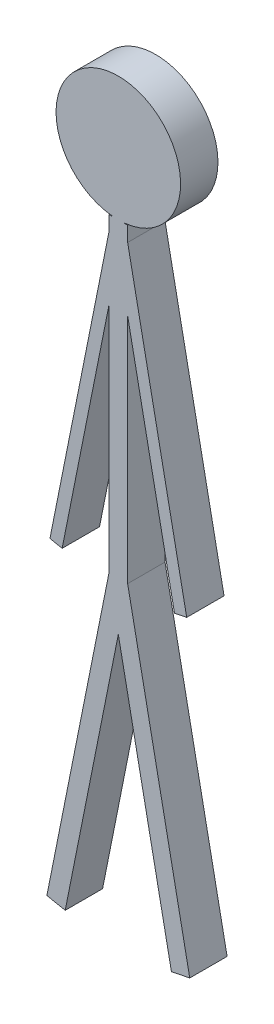
from build123d import *

# Parameters (mm, degrees)
SKETCH1_R           = 12.7
BOSS_EXTRUDE1_DEPTH = 3.81
EXTRUDE_THIN1_START = -3.81
EXTRUDE_THIN1_DEPTH = 7.62
EXTRUDE_THIN4_DEPTH = 3.81
SCALE1_SCALE        = 1.5


# Read off the part's stored shape, not the designer's step: Extrude-Thin1
with BuildPart() as part:
    # Sketch1 → Boss-Extrude1 (new, symmetric)
    with BuildSketch(Plane.XY):
        with Locations(Location((0, 0, 0), (0, 0, 180))):
            Circle(SKETCH1_R)
    extrude(amount=BOSS_EXTRUDE1_DEPTH, both=True)



with BuildPart() as body_2:
    # Extrude-Thin1 outline → Extrude-Thin1 (new body)
    with BuildSketch(Plane.XY.offset(EXTRUDE_THIN1_START)):
        Polygon((14.568006187, -139.326398763), (1.905, -76.011367827), (1.905, -12.7), (-1.905, -12.7), (-1.905, -76.011367827), (-14.568006187, -139.326398763), (-10.831993813, -140.073601237), (0, -85.913632173), (10.831993813, -140.073601237), align=None)
    extrude(amount=EXTRUDE_THIN1_DEPTH)


with BuildPart() as part_1:
    add(part.part)

    add(body_2.part)  # Extrude-Thin4 merges body 2
    # Sketch1<4> → Extrude-Thin4 (add, symmetric)
    with BuildSketch(Plane.XY):
        Polygon((13.945337458, -75.950932508), (0, -6.224245218), (-13.945337458, -75.950932508), (-11.454662542, -76.449067492), (0, -19.175754782), (11.454662542, -76.449067492), align=None)
    extrude(amount=EXTRUDE_THIN4_DEPTH, both=True)


with BuildPart() as part_2:
    # Scale1: scaled about (0, -50.73447441, 0)
    add(part_1.part.scale(SCALE1_SCALE).moved(Location((0, 25.367237205, 0))))


solid = part_2.part
